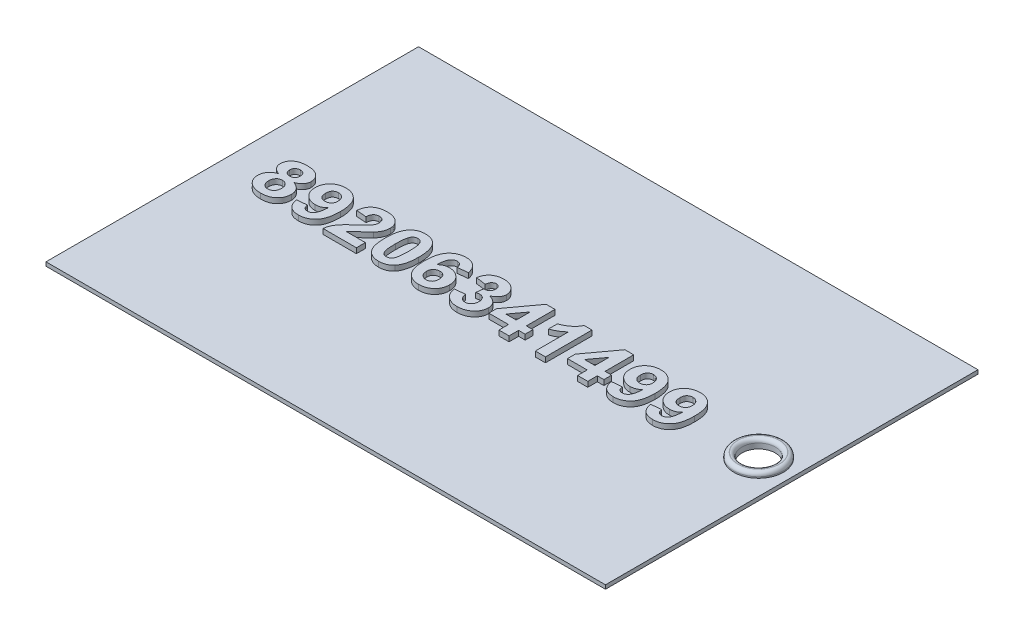
from build123d import *

# Parameters (mm, degrees)
SKETCH_1_W          = 86.5
SKETCH_1_H          = 57.6
EXTRUDE_1_DEPTH     = 0.6
EXTRUDE_2_DEPTH     = 0.8
SKETCH_4_R          = 3.817561334
EXTRUDE_3_DEPTH     = 0.8
SKETCH_6_R          = 2.57898752
CUT_EXTRUDE_1_DEPTH = 1.8
FILLET_1_R          = 0.6


with BuildPart() as part:
    # Эскиз1 → Бобышка-Вытянуть1 (new body)
    with BuildSketch(Plane(origin=(0, 0, 0), x_dir=(1, 0, 0), z_dir=(0, 1, 0))):
        Rectangle(SKETCH_1_W, SKETCH_1_H)
    extrude(amount=EXTRUDE_1_DEPTH)

    # Эскиз2 → Бобышка-Вытянуть2 (add)
    # profile 1 of 11: a face of its own
    with BuildSketch(Plane(origin=(0, 0.6, 0), x_dir=(1, 0, 0), z_dir=(0, 1, 0))):
        with BuildLine():
            add(Edge.make_bspline(
                [(-36.285548398, 0.189662229), (-36.336217326, 0.208249515), (-36.435329018, 0.244607445), (-36.576636112, 0.308436742), (-36.707435743, 0.376604952), (-36.826370801, 0.451592864), (-36.937086754, 0.528059561), (-37.034487713, 0.614103649), (-37.123125063, 0.70282966), (-37.224040922, 0.827712646), (-37.328587221, 0.991967456), (-37.416710796, 1.203180728), (-37.475337374, 1.422983015), (-37.481160232, 1.574149403), (-37.484097118, 1.650393481)],
                knots=[0, 0, 0, 0, 0.958286053, 1.874469368, 2.751924474, 3.575500876, 4.37063306, 5.138446985, 5.88024205, 6.595529584, 7.986847543, 9.320617915, 10.648594961, 12, 12, 12, 12], degree=3))
            add(Edge.make_bspline(
                [(-37.484097118, 1.650393481), (-37.482090341, 1.714839157), (-37.478146025, 1.841506974), (-37.449070542, 2.027277931), (-37.399284622, 2.204302041), (-37.332164765, 2.373660858), (-37.243122203, 2.533595618), (-37.133650181, 2.683858537), (-37.006933234, 2.82689857), (-36.860638307, 2.959716616), (-36.696842178, 3.080367811), (-36.515708278, 3.18664285), (-36.316738031, 3.27331835), (-36.102845759, 3.347967004), (-35.871471108, 3.402834049), (-35.624587499, 3.443454052), (-35.361118613, 3.465853718), (-35.180195806, 3.469425628), (-35.086999679, 3.471265574)],
                knots=[0, 0, 0, 0, 0.914682978, 1.797807145, 2.66113592, 3.520634732, 4.378049579, 5.252103346, 6.155026356, 7.086322986, 8.051602039, 9.038352878, 10.060630283, 11.127721113, 12.250325884, 13.431504408, 14.676928322, 16, 16, 16, 16], degree=3))
            add(Edge.make_bspline(
                [(-35.086999679, 3.471265574), (-34.994763518, 3.469415878), (-34.815279083, 3.46581651), (-34.553732859, 3.443440745), (-34.30825552, 3.402901597), (-34.077973469, 3.347648698), (-33.864746878, 3.27375674), (-33.666356278, 3.185882245), (-33.484369219, 3.080462965), (-33.319151911, 2.959731844), (-33.171535421, 2.826857625), (-33.043111098, 2.684362502), (-32.933970342, 2.533173195), (-32.843322986, 2.373768387), (-32.774425848, 2.204595456), (-32.725021175, 2.027245339), (-32.695829052, 1.841515542), (-32.691900829, 1.714842046), (-32.689902239, 1.650393481)],
                knots=[0, 0, 0, 0, 1.310519152, 2.550168893, 3.725584358, 4.842483071, 5.910449356, 6.927336827, 7.920794406, 8.892366141, 9.829481644, 10.737692221, 11.612463073, 12.473910606, 13.336680849, 14.20071791, 15.084566604, 16, 16, 16, 16], degree=3))
            add(Edge.make_bspline(
                [(-32.689902239, 1.650393481), (-32.690445519, 1.609992), (-32.691523553, 1.529823053), (-32.708926686, 1.411499157), (-32.732438663, 1.296043914), (-32.767703705, 1.184316651), (-32.812001605, 1.076059623), (-32.867783832, 0.972195339), (-32.930986109, 0.870134286), (-33.031693639, 0.740013934), (-33.178902269, 0.587025369), (-33.389707712, 0.430264756), (-33.630252172, 0.292839731), (-33.807196873, 0.224789461), (-33.898534903, 0.189662229)],
                knots=[0, 0, 0, 0, 0.715878892, 1.420523609, 2.117092496, 2.804014019, 3.495199071, 4.188584521, 4.892765842, 5.621847554, 7.103549966, 8.641724018, 10.266473608, 12, 12, 12, 12], degree=3))
            add(Edge.make_bspline(
                [(-33.898534903, 0.189662229), (-33.843051365, 0.169201246), (-33.734127381, 0.129032723), (-33.578444817, 0.058636223), (-33.434041023, -0.02037624), (-33.297532557, -0.102439146), (-33.173959099, -0.196221894), (-33.058428931, -0.293215312), (-32.953224389, -0.397786907), (-32.860789715, -0.510300124), (-32.775896521, -0.626787716), (-32.70504775, -0.749777203), (-32.641139621, -0.875238493), (-32.593480477, -1.006888546), (-32.553893653, -1.141969187), (-32.524608282, -1.281514401), (-32.509222431, -1.426300492), (-32.506757544, -1.524095689), (-32.505510129, -1.57358733)],
                knots=[0, 0, 0, 0, 1.177311303, 2.311270056, 3.397924368, 4.45402987, 5.479033016, 6.482948128, 7.456535392, 8.427348562, 9.379909235, 10.322823475, 11.25073535, 12.179582744, 13.105522015, 14.052499726, 15.014420052, 16, 16, 16, 16], degree=3))
            add(Edge.make_bspline(
                [(-32.505510129, -1.57358733), (-32.507940018, -1.654346328), (-32.51271753, -1.813130167), (-32.543885711, -2.045650498), (-32.599602407, -2.265870339), (-32.674303565, -2.475565792), (-32.772586162, -2.673237646), (-32.893303308, -2.859009058), (-33.035500939, -3.032707319), (-33.197866972, -3.193296371), (-33.377813429, -3.338644341), (-33.572941125, -3.466301155), (-33.783452855, -3.572847711), (-34.007518874, -3.66136674), (-34.246635953, -3.728438447), (-34.499502869, -3.777542272), (-34.767007995, -3.806359166), (-34.950076175, -3.81023757), (-35.043782778, -3.812222799)],
                knots=[0, 0, 0, 0, 1.018464953, 2.00244899, 2.951201689, 3.87829569, 4.804459757, 5.72824528, 6.666426589, 7.629849071, 8.602985074, 9.578811512, 10.56458265, 11.573243485, 12.61213359, 13.691648752, 14.818430642, 16, 16, 16, 16], degree=3))
            add(Edge.make_bspline(
                [(-35.043782778, -3.812222799), (-35.131222507, -3.81036797), (-35.302565562, -3.806733329), (-35.554443769, -3.783941144), (-35.794731837, -3.743844688), (-36.023845072, -3.687191505), (-36.242293185, -3.61610555), (-36.44837178, -3.525069862), (-36.646103988, -3.423478099), (-36.767047724, -3.33963956), (-36.827200224, -3.297941677)],
                knots=[0, 0, 0, 0, 1.112070826, 2.179165159, 3.213263291, 4.207123208, 5.178514106, 6.130358073, 7.070116082, 8, 8, 8, 8], degree=3))
            add(Edge.make_bspline(
                [(-36.827200224, -3.297941677), (-36.894503104, -3.246849777), (-37.026548489, -3.146609646), (-37.195506623, -2.969274872), (-37.344520638, -2.783371637), (-37.462066126, -2.579658255), (-37.556486398, -2.363082996), (-37.61917552, -2.131411253), (-37.662204859, -1.886821), (-37.666359145, -1.718801382), (-37.668489229, -1.632650428)],
                knots=[0, 0, 0, 0, 1.042160326, 2.04467415, 3.016482646, 3.978868424, 4.940760526, 5.926641304, 6.936898956, 8, 8, 8, 8], degree=3))
            add(Edge.make_bspline(
                [(-37.668489229, -1.632650428), (-37.667143745, -1.584602195), (-37.6644739, -1.489260005), (-37.650353513, -1.34754424), (-37.624524559, -1.208678542), (-37.586095233, -1.07341198), (-37.540688476, -0.939913778), (-37.482793766, -0.810509297), (-37.414016998, -0.684435541), (-37.337283421, -0.560527793), (-37.247741226, -0.442278845), (-37.145968536, -0.330481853), (-37.032054799, -0.225638695), (-36.906671624, -0.127308614), (-36.768225101, -0.037766451), (-36.618205594, 0.045161456), (-36.457339475, 0.123990706), (-36.343545893, 0.167491207), (-36.285548398, 0.189662229)],
                knots=[0, 0, 0, 0, 0.941336221, 1.867895066, 2.786591011, 3.703937775, 4.620126515, 5.546494376, 6.476579351, 7.431723818, 8.398651547, 9.377446652, 10.389175869, 11.427786824, 12.494800566, 13.614846226, 14.784351964, 16, 16, 16, 16], degree=3))
        make_face()
        with BuildLine():
            add(Edge.make_bspline(
                [(-35.916764177, 1.542351229), (-35.914096044, 1.48017872), (-35.908982217, 1.361016953), (-35.867601377, 1.192412545), (-35.795134731, 1.045952083), (-35.696662596, 0.92155053), (-35.572061554, 0.82440657), (-35.428406429, 0.7541168), (-35.265424182, 0.713332978), (-35.151100749, 0.708113279), (-35.091321369, 0.705383914)],
                knots=[0, 0, 0, 0, 1.121972408, 2.150407259, 3.108278179, 4.052191964, 4.990713166, 5.936974058, 6.921249925, 8, 8, 8, 8], degree=3))
            add(Edge.make_bspline(
                [(-35.091321369, 0.705383914), (-35.0310374, 0.708013309), (-34.915135388, 0.713068587), (-34.750969824, 0.755407169), (-34.605527694, 0.825975259), (-34.480770781, 0.924452138), (-34.379923784, 1.048903565), (-34.30675944, 1.195690309), (-34.264744147, 1.364798911), (-34.259822528, 1.484005001), (-34.25723518, 1.546672919)],
                knots=[0, 0, 0, 0, 1.079689513, 2.075811998, 3.015368644, 3.959333422, 4.901962196, 5.864590356, 6.8773923, 8, 8, 8, 8], degree=3))
            add(Edge.make_bspline(
                [(-34.25723518, 1.546672919), (-34.259811207, 1.606016294), (-34.2647417, 1.719598992), (-34.307658021, 1.880943237), (-34.378901186, 2.023994422), (-34.479740633, 2.144860471), (-34.601113452, 2.244874184), (-34.744455713, 2.314190068), (-34.904918138, 2.357379702), (-35.018041343, 2.36233431), (-35.076915735, 2.36491291)],
                knots=[0, 0, 0, 0, 1.090784866, 2.087752606, 3.048321147, 4.009174319, 4.964441443, 5.921057094, 6.918024835, 8, 8, 8, 8], degree=3))
            add(Edge.make_bspline(
                [(-35.076915735, 2.36491291), (-35.138153799, 2.362290831), (-35.255471427, 2.357267547), (-35.421822746, 2.315107124), (-35.568419224, 2.243235524), (-35.692245111, 2.142973187), (-35.79371982, 2.021089437), (-35.864806092, 1.877444067), (-35.909559481, 1.715955311), (-35.914300126, 1.601724905), (-35.916764177, 1.542351229)],
                knots=[0, 0, 0, 0, 1.108272365, 2.123187401, 3.084171351, 4.043381648, 4.989083505, 5.934505219, 6.926415291, 8, 8, 8, 8], degree=3))
        make_face(mode=Mode.SUBTRACT)
        with BuildLine():
            add(Edge.make_bspline(
                [(-36.101156288, -1.501559161), (-36.100517912, -1.547700824), (-36.099277669, -1.637345262), (-36.084168562, -1.767818384), (-36.061278165, -1.890614194), (-36.030407288, -2.006341166), (-35.987725597, -2.113487176), (-35.938026463, -2.213746372), (-35.876480996, -2.304830864), (-35.807605681, -2.388443902), (-35.731459074, -2.462890914), (-35.650539894, -2.528248671), (-35.565076196, -2.583331306), (-35.474905227, -2.628644822), (-35.379989905, -2.662925868), (-35.280482825, -2.687258039), (-35.176897373, -2.704260864), (-35.105797549, -2.705328359), (-35.069712918, -2.705870134)],
                knots=[0, 0, 0, 0, 1.241599918, 2.412191547, 3.530285543, 4.60283893, 5.630272913, 6.630426839, 7.609216693, 8.582442034, 9.542267977, 10.470946533, 11.378143532, 12.27422023, 13.18206171, 14.088152821, 15.029698039, 16, 16, 16, 16], degree=3))
            add(Edge.make_bspline(
                [(-35.069712918, -2.705870134), (-35.034619537, -2.70512215), (-34.965086426, -2.703640115), (-34.863504305, -2.689463199), (-34.766932059, -2.663837129), (-34.674476469, -2.631834949), (-34.58757203, -2.586932485), (-34.503549459, -2.536525731), (-34.426682367, -2.472380546), (-34.353395957, -2.401466425), (-34.287009193, -2.320434415), (-34.228730427, -2.230909259), (-34.181879195, -2.131479838), (-34.140837484, -2.02543272), (-34.111374564, -1.909680537), (-34.087870701, -1.786648546), (-34.075255514, -1.654520587), (-34.073662996, -1.564007197), (-34.07284307, -1.517405358)],
                knots=[0, 0, 0, 0, 0.962437785, 1.906949137, 2.804742188, 3.700600337, 4.584269373, 5.483510867, 6.38255937, 7.32338912, 8.278042554, 9.249989229, 10.245659391, 11.287906134, 12.364710024, 13.517024084, 14.721611888, 16, 16, 16, 16], degree=3))
            add(Edge.make_bspline(
                [(-34.07284307, -1.517405358), (-34.073672867, -1.47656049), (-34.075297783, -1.396577707), (-34.088033768, -1.279316984), (-34.111413714, -1.168090889), (-34.142744795, -1.062827415), (-34.183121935, -0.964271625), (-34.232955509, -0.872131552), (-34.291528168, -0.785888924), (-34.359763761, -0.707319797), (-34.432380741, -0.634626253), (-34.512498014, -0.573034785), (-34.596184757, -0.518679526), (-34.685867139, -0.475579924), (-34.780264437, -0.442621268), (-34.878959903, -0.417623083), (-34.982841531, -0.403085524), (-35.053821713, -0.401681843), (-35.089880805, -0.40096875)],
                knots=[0, 0, 0, 0, 1.155918347, 2.263529552, 3.33235739, 4.368544216, 5.367983109, 6.340920378, 7.328554279, 8.31178347, 9.282439969, 10.231253058, 11.166241316, 12.10231545, 13.039375653, 13.991977209, 14.979891594, 16, 16, 16, 16], degree=3))
            add(Edge.make_bspline(
                [(-35.089880805, -0.40096875), (-35.13122014, -0.402151266), (-35.21133457, -0.404442948), (-35.3274248, -0.419910674), (-35.434903894, -0.44789001), (-35.535105565, -0.484654002), (-35.626990849, -0.53449694), (-35.710640932, -0.595147345), (-35.786333712, -0.666224068), (-35.873481092, -0.774264079), (-35.963363966, -0.920609431), (-36.042284, -1.107598405), (-36.092131308, -1.302105399), (-36.098144813, -1.435005011), (-36.101156288, -1.501559161)],
                knots=[0, 0, 0, 0, 0.887516411, 1.719981036, 2.507577094, 3.267707935, 4.005706678, 4.743921389, 5.480478727, 6.227565498, 7.718071651, 9.150217807, 10.572871435, 12, 12, 12, 12], degree=3))
        make_face(mode=Mode.SUBTRACT)
    # profile 2 of 11: a face of its own
    with BuildSketch(Plane(origin=(0, 0.6, 0), x_dir=(1, 0, 0), z_dir=(0, 1, 0))):
        with BuildLine():
            Line((-31.399157464, -1.936609298), (-29.831824523, -1.783909581))
            add(Edge.make_bspline(
                [(-29.831824523, -1.783909581), (-29.821564595, -1.850054803), (-29.802171542, -1.975080793), (-29.747698967, -2.148352361), (-29.671713147, -2.294389344), (-29.574494704, -2.413789744), (-29.456788435, -2.50458782), (-29.321630608, -2.56856708), (-29.16978879, -2.606748116), (-29.063272585, -2.61130293), (-29.007822279, -2.613674079)],
                knots=[0, 0, 0, 0, 1.231193047, 2.327169275, 3.327745251, 4.244636558, 5.139439171, 6.041029258, 6.980197158, 8, 8, 8, 8], degree=3))
            add(Edge.make_bspline(
                [(-29.007822279, -2.613674079), (-28.971688482, -2.612884933), (-28.900266715, -2.611325113), (-28.79564049, -2.589175552), (-28.694479303, -2.558652712), (-28.598074653, -2.512544224), (-28.506186222, -2.455148506), (-28.41812306, -2.384623392), (-28.335624906, -2.300681812), (-28.253771166, -2.204366103), (-28.178856038, -2.086346885), (-28.114206466, -1.94217148), (-28.053891721, -1.773158707), (-28.000745932, -1.577687302), (-27.957651174, -1.355452715), (-27.91914837, -1.107470043), (-27.885202643, -0.83326315), (-27.871289173, -0.641145747), (-27.864014967, -0.540703397)],
                knots=[0, 0, 0, 0, 0.661879668, 1.308265946, 1.954892471, 2.597483001, 3.26258152, 3.939714808, 4.662557812, 5.419667133, 6.255744316, 7.217765111, 8.313252526, 9.546818957, 10.931172992, 12.46549124, 14.152096776, 16, 16, 16, 16], degree=3))
            add(Edge.make_bspline(
                [(-27.864014967, -0.540703397), (-27.912077522, -0.588293592), (-28.007337318, -0.682617174), (-28.164780232, -0.804931633), (-28.3315346, -0.908082145), (-28.507182071, -0.991583243), (-28.69053792, -1.059146252), (-28.884169137, -1.104047751), (-29.086077258, -1.134613171), (-29.224268784, -1.137215004), (-29.294494388, -1.138537193)],
                knots=[0, 0, 0, 0, 1.016554157, 2.014806384, 2.99086776, 3.959930652, 4.935430789, 5.923362918, 6.944703054, 8, 8, 8, 8], degree=3))
            add(Edge.make_bspline(
                [(-29.294494388, -1.138537193), (-29.370929704, -1.136511256), (-29.521946174, -1.132508526), (-29.744408577, -1.103382513), (-29.959066352, -1.054209545), (-30.165783838, -0.98511896), (-30.363700596, -0.895021852), (-30.554024203, -0.786422476), (-30.735380113, -0.656988684), (-30.909509506, -0.512138885), (-31.066047116, -0.348301262), (-31.206697516, -0.174011022), (-31.322211711, 0.015509487), (-31.417109257, 0.216118813), (-31.49296507, 0.427736667), (-31.545974891, 0.651374994), (-31.578362039, 0.88689803), (-31.581797653, 1.048132074), (-31.583549575, 1.130350106)],
                knots=[0, 0, 0, 0, 1.01884352, 2.012972034, 2.985091286, 3.950717898, 4.91336916, 5.87969577, 6.867227362, 7.88032292, 8.894449453, 9.883225206, 10.860390094, 11.84542865, 12.837576497, 13.851480752, 14.904406168, 16, 16, 16, 16], degree=3))
            add(Edge.make_bspline(
                [(-31.583549575, 1.130350106), (-31.581135419, 1.215909094), (-31.576398726, 1.383780036), (-31.545195387, 1.629164517), (-31.489822398, 1.861656075), (-31.413530503, 2.081475065), (-31.315436792, 2.289321284), (-31.193097387, 2.482540039), (-31.051429964, 2.664717155), (-30.886929142, 2.830030093), (-30.707784297, 2.981453567), (-30.514312487, 3.113070619), (-30.307654842, 3.22300507), (-30.090148815, 3.313716529), (-29.860620869, 3.384953228), (-29.619402367, 3.434706942), (-29.365896907, 3.465837738), (-29.192786968, 3.469430121), (-29.104340024, 3.471265574)],
                knots=[0, 0, 0, 0, 1.072024232, 2.103364261, 3.092786983, 4.061299559, 5.013985084, 5.965511011, 6.921155665, 7.899689109, 8.881878012, 9.856426617, 10.825443631, 11.809841357, 12.805118757, 13.831709527, 14.892156814, 16, 16, 16, 16], degree=3))
            add(Edge.make_bspline(
                [(-29.104340024, 3.471265574), (-29.008661189, 3.468802344), (-28.820331603, 3.463953839), (-28.544387055, 3.424906316), (-28.28218581, 3.357730728), (-28.032227736, 3.267402563), (-27.796590471, 3.148425708), (-27.573996486, 3.002797135), (-27.365499566, 2.83070865), (-27.168908229, 2.633724759), (-26.989492819, 2.406616685), (-26.837556478, 2.142788317), (-26.707713453, 1.846570165), (-26.601780783, 1.516830249), (-26.520619839, 1.153130398), (-26.462854899, 0.756351924), (-26.426117607, 0.325765591), (-26.422464709, 0.027437992), (-26.420570475, -0.127261711)],
                knots=[0, 0, 0, 0, 0.901643998, 1.774752374, 2.620046557, 3.449140987, 4.275016872, 5.10233027, 5.951360725, 6.818713095, 7.721447077, 8.670848442, 9.680069745, 10.76504824, 11.930062553, 13.188538504, 14.542098488, 16, 16, 16, 16], degree=3))
            add(Edge.make_bspline(
                [(-26.420570475, -0.127261711), (-26.422338153, -0.284370687), (-26.425754683, -0.588027529), (-26.464350915, -1.026255369), (-26.523203352, -1.430861038), (-26.607221207, -1.801922474), (-26.717940615, -2.138562924), (-26.85170813, -2.442422623), (-27.009782163, -2.71299869), (-27.194948703, -2.94759973), (-27.397992016, -3.151847925), (-27.616332696, -3.328739656), (-27.850077273, -3.477748935), (-28.097178436, -3.601646353), (-28.360281503, -3.694952557), (-28.637281481, -3.762465605), (-28.929141777, -3.80592374), (-29.12915314, -3.810095984), (-29.2311096, -3.812222799)],
                knots=[0, 0, 0, 0, 1.432153676, 2.768035743, 4.007693005, 5.15793701, 6.232359531, 7.233943367, 8.180075472, 9.081348856, 9.951322331, 10.801277852, 11.638106955, 12.474202681, 13.316238609, 14.177453051, 15.070950615, 16, 16, 16, 16], degree=3))
            add(Edge.make_bspline(
                [(-29.2311096, -3.812222799), (-29.304629942, -3.810884117), (-29.448160878, -3.80827066), (-29.658267565, -3.786576206), (-29.857252883, -3.749329132), (-30.044989984, -3.697160412), (-30.222517281, -3.632654987), (-30.389118684, -3.551603949), (-30.544372392, -3.454682661), (-30.690091794, -3.344911249), (-30.822782176, -3.219141434), (-30.942789149, -3.078163215), (-31.051289649, -2.923607542), (-31.146560439, -2.754129066), (-31.228337761, -2.570027786), (-31.29911797, -2.37226295), (-31.356724691, -2.159699585), (-31.384777381, -2.01221258), (-31.399157464, -1.936609298)],
                knots=[0, 0, 0, 0, 1.112623894, 2.17213286, 3.192787055, 4.173209248, 5.118323106, 6.047995836, 6.971740124, 7.884640988, 8.804947649, 9.732828744, 10.682542674, 11.658888362, 12.670653346, 13.728166063, 14.835435681, 16, 16, 16, 16], degree=3))
        make_face()
        with BuildLine():
            add(Edge.make_bspline(
                [(-27.987903416, 1.095776586), (-27.989225744, 1.141422065), (-27.991793575, 1.230061143), (-28.005426373, 1.359014349), (-28.031839292, 1.479493862), (-28.067792296, 1.592455358), (-28.113622187, 1.698027886), (-28.170578959, 1.795378626), (-28.236680076, 1.885304524), (-28.338337929, 1.991215341), (-28.47808328, 2.10308682), (-28.663198349, 2.202467214), (-28.862474222, 2.262560892), (-29.000216063, 2.269309339), (-29.069766503, 2.272716855)],
                knots=[0, 0, 0, 0, 0.91799807, 1.782662894, 2.60262069, 3.393412986, 4.162938389, 4.911402136, 5.65674597, 6.401151281, 7.857682046, 9.235448926, 10.60408614, 12, 12, 12, 12], degree=3))
            add(Edge.make_bspline(
                [(-29.069766503, 2.272716855), (-29.134890107, 2.269845668), (-29.261708514, 2.264254465), (-29.443101733, 2.215728382), (-29.606809189, 2.134504672), (-29.727350751, 2.041872269), (-29.813035699, 1.952232492), (-29.866982503, 1.87228354), (-29.913844889, 1.783551382), (-29.950831645, 1.684102156), (-29.981432683, 1.575371542), (-30.000479151, 1.455471874), (-30.014046542, 1.32657872), (-30.015478938, 1.236991786), (-30.016216634, 1.190853768)],
                knots=[0, 0, 0, 0, 1.431664542, 2.787951052, 4.097338494, 5.431366142, 6.111873526, 6.818476973, 7.546573036, 8.316072833, 9.149487248, 10.028760014, 10.984794968, 12, 12, 12, 12], degree=3))
            add(Edge.make_bspline(
                [(-30.016216634, 1.190853768), (-30.015599855, 1.143748654), (-30.014407174, 1.052660372), (-29.9992135, 0.920780596), (-29.977079507, 0.798695912), (-29.944950789, 0.686387119), (-29.904921073, 0.583120832), (-29.854822709, 0.48959384), (-29.794783982, 0.405738101), (-29.703055437, 0.309391902), (-29.572336421, 0.208732719), (-29.394611679, 0.123192974), (-29.199214208, 0.068888171), (-29.062451612, 0.063030209), (-28.991976082, 0.060011526)],
                knots=[0, 0, 0, 0, 0.979097379, 1.893303947, 2.757030447, 3.556730337, 4.31888723, 5.056103087, 5.757267517, 6.456651888, 7.816854138, 9.161164295, 10.537111332, 12, 12, 12, 12], degree=3))
            add(Edge.make_bspline(
                [(-28.991976082, 0.060011526), (-28.92389319, 0.062560024), (-28.791000558, 0.067534498), (-28.601569127, 0.120890486), (-28.427134399, 0.201424951), (-28.300146021, 0.298768398), (-28.209303611, 0.390075996), (-28.150445732, 0.468487791), (-28.099368497, 0.55429968), (-28.057718151, 0.648049407), (-28.025776004, 0.749553071), (-28.005388193, 0.858446618), (-27.989603383, 0.974316268), (-27.988482246, 1.054419973), (-27.987903416, 1.095776586)],
                knots=[0, 0, 0, 0, 1.500879801, 2.929603369, 4.315716618, 5.725035421, 6.437957177, 7.157483113, 7.885489455, 8.640828255, 9.419513109, 10.231197387, 11.086787741, 12, 12, 12, 12], degree=3))
        make_face(mode=Mode.SUBTRACT)
    # profile 3 of 11: a face of its own
    with BuildSketch(Plane(origin=(0, 0.6, 0), x_dir=(1, 0, 0), z_dir=(0, 1, 0))):
        with BuildLine():
            Line((-20.335630822, -2.337085913), (-20.335630822, -3.720026743))
            Line((-20.335630822, -3.720026743), (-25.498609922, -3.720026743))
            add(Edge.make_bspline(
                [(-25.498609922, -3.720026743), (-25.480799957, -3.601786717), (-25.445138625, -3.365031804), (-25.339992547, -3.019138653), (-25.196355403, -2.682374976), (-25.041658042, -2.408776215), (-24.888903576, -2.187961761), (-24.748302836, -2.008197999), (-24.583718602, -1.814753993), (-24.392871548, -1.610073674), (-24.179573887, -1.389612341), (-23.938431186, -1.159597123), (-23.674940433, -0.913428403), (-23.4880167, -0.748627766), (-23.391065719, -0.663151283)],
                knots=[0, 0, 0, 0, 1.129476727, 2.261579045, 3.406926059, 4.586285963, 5.226122553, 5.94455893, 6.743413178, 7.627078971, 8.590393361, 9.643699672, 10.777867183, 12, 12, 12, 12], degree=3))
            add(Edge.make_bspline(
                [(-23.391065719, -0.663151283), (-23.31420272, -0.594521951), (-23.167851859, -0.463848388), (-22.959412275, -0.276697591), (-22.775343121, -0.105355697), (-22.61441449, 0.048250464), (-22.476166992, 0.183811233), (-22.362849779, 0.303413051), (-22.270708611, 0.404335341), (-22.221437061, 0.469305934), (-22.199719816, 0.497942789)],
                knots=[0, 0, 0, 0, 1.484766696, 2.827067485, 4.036323289, 5.10806564, 6.032765945, 6.825596682, 7.482362455, 8, 8, 8, 8], degree=3))
            add(Edge.make_bspline(
                [(-22.199719816, 0.497942789), (-22.154622499, 0.566971834), (-22.067982945, 0.699588276), (-21.97241575, 0.90948264), (-21.914702569, 1.119582156), (-21.906828787, 1.260147943), (-21.902963763, 1.329147851)],
                knots=[0, 0, 0, 0, 1.102927588, 2.118909982, 3.076624261, 4, 4, 4, 4], degree=3))
            add(Edge.make_bspline(
                [(-21.902963763, 1.329147851), (-21.905249173, 1.400963923), (-21.909579873, 1.537050598), (-21.954737607, 1.728372605), (-22.029884643, 1.894101283), (-22.136777163, 2.031380628), (-22.269627675, 2.140587425), (-22.42628546, 2.219490851), (-22.607398897, 2.264079369), (-22.734878396, 2.269741251), (-22.801875303, 2.272716855)],
                knots=[0, 0, 0, 0, 1.163090258, 2.203978577, 3.165718603, 4.092675497, 5.000155709, 5.933633661, 6.914020271, 8, 8, 8, 8], degree=3))
            add(Edge.make_bspline(
                [(-22.801875303, 2.272716855), (-22.867954496, 2.26993862), (-22.994797081, 2.264605647), (-23.17497403, 2.216484331), (-23.332664512, 2.133594834), (-23.446415382, 2.03942691), (-23.523063087, 1.946934412), (-23.575331749, 1.86676975), (-23.62115259, 1.775961679), (-23.659992329, 1.674553738), (-23.691268548, 1.562521518), (-23.717232096, 1.440373777), (-23.735633889, 1.306971276), (-23.743038905, 1.214428431), (-23.74688487, 1.166364191)],
                knots=[0, 0, 0, 0, 1.446541196, 2.776714027, 4.047779858, 5.325278425, 5.982890428, 6.674732488, 7.41842877, 8.208071155, 9.050911754, 9.965360861, 10.943263679, 12, 12, 12, 12], degree=3))
            Line((-23.74688487, 1.166364191), (-25.314217811, 1.301777147))
            add(Edge.make_bspline(
                [(-25.314217811, 1.301777147), (-25.301777475, 1.395186991), (-25.277629006, 1.576508844), (-25.217958402, 1.836636123), (-25.142600931, 2.076691424), (-25.048069797, 2.296058025), (-24.938061831, 2.496350994), (-24.807431695, 2.674195753), (-24.660296472, 2.832265498), (-24.495411688, 2.969085675), (-24.315390319, 3.086066098), (-24.126934456, 3.190902387), (-23.926482871, 3.277517442), (-23.715138434, 3.34762546), (-23.49343868, 3.404627361), (-23.26046647, 3.441950251), (-23.017600762, 3.468228456), (-22.851889879, 3.470239186), (-22.767301782, 3.471265574)],
                knots=[0, 0, 0, 0, 1.209071725, 2.346980976, 3.421064628, 4.434374677, 5.408437173, 6.347872138, 7.259308193, 8.173989875, 9.090310792, 10.011696864, 10.939227016, 11.888478621, 12.867676192, 13.8739127, 14.914726209, 16, 16, 16, 16], degree=3))
            add(Edge.make_bspline(
                [(-22.767301782, 3.471265574), (-22.675053325, 3.469642298), (-22.495455152, 3.466481946), (-22.233743461, 3.440949106), (-21.98756822, 3.395206046), (-21.755335727, 3.336732679), (-21.539250987, 3.256130993), (-21.337545601, 3.160434853), (-21.152790964, 3.043703023), (-20.982745402, 2.91372224), (-20.832117712, 2.768981803), (-20.698139924, 2.616913143), (-20.586962013, 2.453644934), (-20.493395121, 2.283545361), (-20.42275689, 2.103224934), (-20.372319699, 1.914809268), (-20.341174409, 1.717693556), (-20.337498657, 1.583281867), (-20.335630822, 1.514980525)],
                knots=[0, 0, 0, 0, 1.265063819, 2.462947978, 3.60097199, 4.696747314, 5.742727476, 6.758926912, 7.752990665, 8.734342278, 9.689262861, 10.613604176, 11.508696777, 12.392746404, 13.270815088, 14.157436591, 15.063700826, 16, 16, 16, 16], degree=3))
            add(Edge.make_bspline(
                [(-20.335630822, 1.514980525), (-20.337762546, 1.436569408), (-20.341994709, 1.280897943), (-20.378505383, 1.0509132), (-20.433670516, 0.825932665), (-20.516508398, 0.605883054), (-20.623197932, 0.386390523), (-20.755701115, 0.163700918), (-20.914191908, -0.06396187), (-21.03519009, -0.212091795), (-21.097688842, -0.288604808)],
                knots=[0, 0, 0, 0, 0.939476924, 1.865166004, 2.785271292, 3.712391279, 4.677910533, 5.707657932, 6.815944874, 8, 8, 8, 8], degree=3))
            add(Edge.make_bspline(
                [(-21.097688842, -0.288604808), (-21.122014264, -0.316124507), (-21.174009212, -0.374947138), (-21.260867179, -0.465865035), (-21.36187875, -0.564656958), (-21.475778925, -0.67314902), (-21.60428664, -0.789554366), (-21.746408521, -0.915021782), (-21.904418305, -1.046808029), (-22.068995478, -1.185825627), (-22.23386787, -1.32132805), (-22.385893484, -1.449294231), (-22.522045584, -1.564727412), (-22.641115866, -1.668542728), (-22.744907299, -1.758687455), (-22.831761747, -1.83702379), (-22.902818132, -1.902393161), (-23.000755223, -2.004443725), (-23.125877758, -2.141399176), (-23.214822909, -2.274046442), (-23.257093326, -2.337085913)],
                knots=[0, 0, 0, 0, 0.664437529, 1.420217667, 2.274078834, 3.220377861, 4.265797111, 5.410719718, 6.649816042, 7.987887578, 9.308159569, 10.510534661, 11.582823297, 12.537340636, 13.368449574, 14.0696897, 14.653539676, 15.114285161, 16.628588878, 18, 18, 18, 18], degree=3))
            Line((-23.257093326, -2.337085913), (-20.335630822, -2.337085913))
        make_face()
    # profile 4 of 11: a face of its own
    with BuildSketch(Plane(origin=(0, 0.6, 0), x_dir=(1, 0, 0), z_dir=(0, 1, 0))):
        with BuildLine():
            add(Edge.make_bspline(
                [(-16.832180718, 3.471265574), (-16.738432579, 3.469170439), (-16.555550316, 3.465083285), (-16.28924115, 3.429853583), (-16.038216072, 3.372449554), (-15.802743952, 3.292059674), (-15.5826398, 3.188056449), (-15.380673774, 3.057794802), (-15.190774155, 2.909099497), (-15.080932849, 2.791417015), (-15.025714259, 2.732256568)],
                knots=[0, 0, 0, 0, 1.116340652, 2.177738199, 3.193406861, 4.179258887, 5.136143586, 6.085062405, 7.037337072, 8, 8, 8, 8], degree=3))
            add(Edge.make_bspline(
                [(-15.025714259, 2.732256568), (-14.993880044, 2.694804407), (-14.929236482, 2.618752868), (-14.842851348, 2.494334374), (-14.759179927, 2.363177222), (-14.685606058, 2.220912179), (-14.613735281, 2.071406067), (-14.551670837, 1.911433474), (-14.493380593, 1.743436744), (-14.441610767, 1.566593986), (-14.397246842, 1.379901508), (-14.358551823, 1.184287588), (-14.325533571, 0.979586721), (-14.298244337, 0.766262099), (-14.276856556, 0.544301627), (-14.26064303, 0.313279709), (-14.252394373, 0.073038794), (-14.251265435, -0.090281918), (-14.250691168, -0.173359739)],
                knots=[0, 0, 0, 0, 0.768149118, 1.559827843, 2.366078024, 3.19908553, 4.062305773, 4.958844896, 5.880163783, 6.842457966, 7.838634207, 8.879724376, 9.959831673, 11.0802147, 12.24200117, 13.446202482, 14.700936759, 16, 16, 16, 16], degree=3))
            add(Edge.make_bspline(
                [(-14.250691168, -0.173359739), (-14.251258129, -0.256437746), (-14.252369429, -0.419278948), (-14.260685241, -0.659037813), (-14.276867776, -0.889577733), (-14.298194077, -1.111551281), (-14.325713897, -1.324829257), (-14.357855789, -1.529324382), (-14.399327309, -1.723995585), (-14.442985077, -1.910435398), (-14.494746666, -2.087948829), (-14.554521736, -2.25608976), (-14.617058873, -2.416937384), (-14.687716785, -2.567804773), (-14.764263479, -2.709675561), (-14.846610655, -2.842352485), (-14.933998579, -2.967443446), (-14.99916313, -3.043929671), (-15.031476512, -3.081857173)],
                knots=[0, 0, 0, 0, 1.297160023, 2.542563356, 3.745000429, 4.905084801, 6.023826389, 7.102351253, 8.136059708, 9.130776481, 10.091660836, 11.021173619, 11.91639925, 12.785143122, 13.620470683, 14.431903381, 15.222422241, 16, 16, 16, 16], degree=3))
            add(Edge.make_bspline(
                [(-15.031476512, -3.081857173), (-15.086845884, -3.140355718), (-15.196497521, -3.256204264), (-15.38337274, -3.405708228), (-15.585833616, -3.531269205), (-15.804410561, -3.634221061), (-16.038397744, -3.71557595), (-16.28948065, -3.770252385), (-16.555514305, -3.806195139), (-16.738420375, -3.810180066), (-16.832180718, -3.812222799)],
                knots=[0, 0, 0, 0, 0.963042427, 1.907176745, 2.854384039, 3.808053903, 4.793049076, 5.812153135, 6.878477497, 8, 8, 8, 8], degree=3))
            add(Edge.make_bspline(
                [(-16.832180718, -3.812222799), (-16.926912418, -3.809779803), (-17.111861744, -3.805010222), (-17.382040657, -3.766337867), (-17.638697313, -3.705048483), (-17.881345942, -3.617114441), (-18.109498229, -3.503380364), (-18.324308859, -3.366250818), (-18.523487777, -3.201889673), (-18.677521266, -3.046159041), (-18.792399341, -2.907538821), (-18.872549313, -2.791943733), (-18.94798333, -2.667526386), (-19.016980458, -2.533110914), (-19.080418332, -2.388771032), (-19.137559542, -2.234050245), (-19.190912469, -2.070309799), (-19.238462619, -1.896769816), (-19.280104849, -1.713618896), (-19.315936492, -1.520407441), (-19.346225283, -1.31715533), (-19.36982541, -1.104199712), (-19.391151348, -0.881955579), (-19.402695912, -0.649791878), (-19.412256501, -0.407770086), (-19.413192733, -0.242997961), (-19.413670268, -0.158954105)],
                knots=[0, 0, 0, 0, 1.336956711, 2.610205926, 3.845082282, 5.05679543, 6.245299989, 7.437588374, 8.64679547, 9.883642899, 10.524261855, 11.186297686, 11.867630116, 12.577150567, 13.317825726, 14.092264323, 14.904816371, 15.74855914, 16.631718945, 17.555848619, 18.522303531, 19.532268663, 20.580618725, 21.673824082, 22.813508086, 24, 24, 24, 24], degree=3))
            add(Edge.make_bspline(
                [(-19.413670268, -0.158954105), (-19.413107941, -0.076355891), (-19.41200585, 0.085525993), (-19.403610568, 0.324319008), (-19.387599347, 0.553913868), (-19.36602074, 0.775377676), (-19.33886229, 0.987752317), (-19.306155704, 1.191655737), (-19.26565071, 1.386190567), (-19.219268248, 1.571449719), (-19.169898933, 1.749130558), (-19.109658762, 1.916510984), (-19.047709528, 2.077126274), (-18.976243246, 2.227140619), (-18.900147859, 2.368741331), (-18.817738009, 2.501389375), (-18.730365955, 2.626487649), (-18.665199334, 2.70297292), (-18.632884925, 2.740899948)],
                knots=[0, 0, 0, 0, 1.293231498, 2.534567525, 3.740331748, 4.896143442, 6.017980594, 7.092068857, 8.128637588, 9.127890194, 10.08211952, 11.01420427, 11.911906995, 12.776247596, 13.613886512, 14.427564449, 15.22027068, 16, 16, 16, 16], degree=3))
            add(Edge.make_bspline(
                [(-18.632884925, 2.740899948), (-18.577517828, 2.799403578), (-18.467870698, 2.915262193), (-18.280962151, 3.064691697), (-18.078258463, 3.19076587), (-17.859178713, 3.29256079), (-17.625613087, 3.374964635), (-17.374854202, 3.42922421), (-17.108854313, 3.46525708), (-16.925943495, 3.469229337), (-16.832180718, 3.471265574)],
                knots=[0, 0, 0, 0, 0.963070378, 1.907232097, 2.854466881, 3.813361818, 4.792956001, 5.812089638, 6.878444947, 8, 8, 8, 8], degree=3))
        make_face()
        with BuildLine():
            add(Edge.make_bspline(
                [(-16.832180718, 2.272716855), (-16.878447863, 2.270803887), (-16.969030893, 2.267058629), (-17.100995408, 2.236686916), (-17.225871017, 2.189528194), (-17.343394987, 2.120895928), (-17.451552441, 2.026796946), (-17.54380923, 1.900177143), (-17.624382623, 1.745088937), (-17.664034556, 1.628479541), (-17.68499423, 1.566840806)],
                knots=[0, 0, 0, 0, 0.924396606, 1.809807974, 2.694437751, 3.585508084, 4.517852362, 5.539680896, 6.699496232, 8, 8, 8, 8], degree=3))
            add(Edge.make_bspline(
                [(-17.68499423, 1.566840806), (-17.698056056, 1.520405994), (-17.726116771, 1.420650107), (-17.758229017, 1.257883757), (-17.784826403, 1.073160365), (-17.808214008, 0.866627017), (-17.824428012, 0.637835199), (-17.837799266, 0.387156672), (-17.844402419, 0.114307367), (-17.845675193, -0.074918782), (-17.846337327, -0.173359739)],
                knots=[0, 0, 0, 0, 0.660252385, 1.418419934, 2.269194707, 3.215235024, 4.263575872, 5.409092646, 6.652134504, 8, 8, 8, 8], degree=3))
            add(Edge.make_bspline(
                [(-17.846337327, -0.173359739), (-17.845535808, -0.271318212), (-17.84399943, -0.459088177), (-17.839281322, -0.728574012), (-17.827427817, -0.973990277), (-17.812060935, -1.195954372), (-17.792069278, -1.3943796), (-17.768835374, -1.569170167), (-17.738124691, -1.719437499), (-17.696561438, -1.883308229), (-17.631359827, -2.053708688), (-17.546698205, -2.227876072), (-17.451065351, -2.365220803), (-17.34205911, -2.464681939), (-17.223949984, -2.531410962), (-17.100877772, -2.579898515), (-16.968791731, -2.607464913), (-16.878401382, -2.611573284), (-16.832180718, -2.613674079)],
                knots=[0, 0, 0, 0, 1.595810556, 3.058901205, 4.390151034, 5.597842767, 6.68285049, 7.638635466, 8.468565781, 9.180044325, 10.39036775, 11.432838799, 12.329430933, 13.099234835, 13.814316259, 14.527555626, 15.247072764, 16, 16, 16, 16], degree=3))
            add(Edge.make_bspline(
                [(-16.832180718, -2.613674079), (-16.785930111, -2.611698651), (-16.694910274, -2.607811067), (-16.562703889, -2.578199088), (-16.438190918, -2.530060341), (-16.320851948, -2.461972683), (-16.212987792, -2.367266309), (-16.118643868, -2.242046872), (-16.040456231, -2.085523155), (-16.00051684, -1.969328254), (-15.979367206, -1.90779803)],
                knots=[0, 0, 0, 0, 0.92418851, 1.818775815, 2.694249029, 3.585118767, 4.51725316, 5.544655608, 6.699788997, 8, 8, 8, 8], degree=3))
            add(Edge.make_bspline(
                [(-15.979367206, -1.90779803), (-15.966324377, -1.861359193), (-15.938431717, -1.762047713), (-15.906093391, -1.600298681), (-15.879421442, -1.41653292), (-15.856247975, -1.210937259), (-15.839854931, -0.982640103), (-15.826577929, -0.73243433), (-15.819967423, -0.460066706), (-15.818688093, -0.271320599), (-15.818024109, -0.173359739)],
                knots=[0, 0, 0, 0, 0.662411386, 1.416595652, 2.263628329, 3.212762163, 4.257953731, 5.407216301, 6.654322858, 8, 8, 8, 8], degree=3))
            add(Edge.make_bspline(
                [(-15.818024109, -0.173359739), (-15.818820538, -0.075400756), (-15.820347157, 0.112370185), (-15.825140315, 0.382328985), (-15.836817111, 0.628245827), (-15.852477959, 0.850159805), (-15.87154785, 1.048340999), (-15.898173735, 1.222052911), (-15.925155086, 1.373199642), (-15.970727351, 1.536342599), (-16.032027894, 1.708436355), (-16.117768906, 1.882604224), (-16.213683613, 2.020018714), (-16.322252769, 2.120613992), (-16.43999011, 2.189367187), (-16.563729614, 2.236963508), (-16.695350407, 2.267012255), (-16.78592029, 2.270788209), (-16.832180718, 2.272716855)],
                knots=[0, 0, 0, 0, 1.594097831, 3.055618199, 4.393244489, 5.599640052, 6.675709638, 7.631587258, 8.459115708, 9.171846621, 10.385508173, 11.426860377, 12.322490231, 13.09672995, 13.815007491, 14.527481364, 15.247880853, 16, 16, 16, 16], degree=3))
        make_face(mode=Mode.SUBTRACT)
    # profile 5 of 11: a face of its own
    with BuildSketch(Plane(origin=(0, 0.6, 0), x_dir=(1, 0, 0), z_dir=(0, 1, 0))):
        with BuildLine():
            Line((-8.350143626, 1.59421151), (-9.917476567, 1.442952357))
            add(Edge.make_bspline(
                [(-9.917476567, 1.442952357), (-9.926879762, 1.509686236), (-9.944625912, 1.635629538), (-10.002133932, 1.807734246), (-10.076011037, 1.954676283), (-10.174858965, 2.071891341), (-10.290568862, 2.163303085), (-10.423250877, 2.2276246), (-10.57179974, 2.265675857), (-10.675943351, 2.270312302), (-10.729954305, 2.272716855)],
                knots=[0, 0, 0, 0, 1.24815344, 2.35557362, 3.352034663, 4.281883764, 5.176746509, 6.069432672, 6.998769271, 8, 8, 8, 8], degree=3))
            add(Edge.make_bspline(
                [(-10.729954305, 2.272716855), (-10.766552279, 2.271868371), (-10.839367121, 2.270180238), (-10.945639101, 2.248769918), (-11.048240249, 2.21695543), (-11.146370633, 2.172482988), (-11.239522653, 2.113366214), (-11.328660969, 2.043158901), (-11.41308368, 1.959150984), (-11.495261683, 1.862564396), (-11.569747021, 1.743882844), (-11.637550169, 1.601599792), (-11.695435558, 1.431589413), (-11.746070997, 1.23532666), (-11.792700689, 1.013427371), (-11.82840542, 0.764502449), (-11.861228731, 0.489402041), (-11.874189137, 0.296347417), (-11.880964433, 0.195424483)],
                knots=[0, 0, 0, 0, 0.667223093, 1.327498168, 1.970791897, 2.625983588, 3.287654104, 3.980478248, 4.69342329, 5.458978853, 6.290746786, 7.243623896, 8.33053425, 9.563927688, 10.942903473, 12.467978657, 14.153569439, 16, 16, 16, 16], degree=3))
            add(Edge.make_bspline(
                [(-11.880964433, 0.195424483), (-11.833486553, 0.243605565), (-11.73964174, 0.338840328), (-11.582860588, 0.460451035), (-11.419069602, 0.565899043), (-11.246034842, 0.651034874), (-11.063989741, 0.715700392), (-10.874685392, 0.764125234), (-10.675992475, 0.791211909), (-10.540837646, 0.795432989), (-10.472093462, 0.797579969)],
                knots=[0, 0, 0, 0, 1.027880298, 2.031708983, 3.010350495, 3.987027629, 4.957375536, 5.944078772, 6.954290959, 8, 8, 8, 8], degree=3))
            add(Edge.make_bspline(
                [(-10.472093462, 0.797579969), (-10.39422661, 0.795529309), (-10.240833619, 0.791489632), (-10.014792894, 0.762885639), (-9.7976373, 0.71146276), (-9.588662026, 0.642672778), (-9.387674891, 0.554703757), (-9.197392551, 0.443474128), (-9.01356549, 0.315774), (-8.841764026, 0.167584438), (-8.68445521, 0.004696775), (-8.544275339, -0.170293064), (-8.427190161, -0.358580817), (-8.332282379, -0.55853281), (-8.256050303, -0.76907556), (-8.203691671, -0.991433441), (-8.170804299, -1.22542392), (-8.167461396, -1.385240261), (-8.165751515, -1.466985641)],
                knots=[0, 0, 0, 0, 1.034996023, 2.038879594, 3.02203398, 3.996948799, 4.960006787, 5.932222426, 6.922087842, 7.931495914, 8.942658201, 9.928543807, 10.906212864, 11.882610095, 12.865847357, 13.876788014, 14.913986076, 16, 16, 16, 16], degree=3))
            add(Edge.make_bspline(
                [(-8.165751515, -1.466985641), (-8.168104698, -1.553513), (-8.172696656, -1.72236084), (-8.204510315, -1.969543562), (-8.258940817, -2.203224928), (-8.336078101, -2.424237265), (-8.4337195, -2.632395905), (-8.554499812, -2.826884657), (-8.696639463, -3.007897289), (-8.858962518, -3.174473493), (-9.039227203, -3.323635592), (-9.232006276, -3.455610361), (-9.438836792, -3.565220638), (-9.656377004, -3.656836851), (-9.887565993, -3.72538508), (-10.130323868, -3.775955478), (-10.385833965, -3.806668463), (-10.560363242, -3.810348093), (-10.649282756, -3.812222799)],
                knots=[0, 0, 0, 0, 1.080953547, 2.10935214, 3.10763085, 4.073381176, 5.028771065, 5.974410373, 6.927329478, 7.898876365, 8.874416079, 9.84618522, 10.812438546, 11.794028718, 12.790448888, 13.819984307, 14.889321379, 16, 16, 16, 16], degree=3))
            add(Edge.make_bspline(
                [(-10.649282756, -3.812222799), (-10.744973972, -3.809831012), (-10.932376744, -3.805146911), (-11.207213064, -3.765384776), (-11.468902743, -3.699169691), (-11.717553851, -3.606645839), (-11.95353854, -3.488870704), (-12.176514336, -3.344680778), (-12.383822063, -3.170629263), (-12.581953407, -2.975297373), (-12.761171263, -2.7474795), (-12.913137441, -2.483750133), (-13.043088266, -2.188175053), (-13.147332889, -1.85853328), (-13.228624096, -1.496015742), (-13.286450838, -1.10019233), (-13.323145021, -0.67152673), (-13.326824995, -0.374637843), (-13.328730615, -0.22089833)],
                knots=[0, 0, 0, 0, 0.90354777, 1.769518291, 2.616597267, 3.449013198, 4.270544968, 5.103405658, 5.950727475, 6.823112593, 7.727752649, 8.679158623, 9.690510842, 10.772069633, 11.939543809, 13.196190923, 14.548089002, 16, 16, 16, 16], degree=3))
            add(Edge.make_bspline(
                [(-13.328730615, -0.22089833), (-13.326965019, -0.063308611), (-13.323552171, 0.241308079), (-13.284916696, 0.680961841), (-13.22618323, 1.087040678), (-13.141893384, 1.458813013), (-13.032803185, 1.796762414), (-12.899319708, 2.101123755), (-12.74094676, 2.372036987), (-12.555785166, 2.60662607), (-12.35279079, 2.81095746), (-12.134571522, 2.987284275), (-11.901917801, 3.137265229), (-11.655311231, 3.260264252), (-11.392982543, 3.354322458), (-11.116773936, 3.421282871), (-10.825939995, 3.465010423), (-10.626875292, 3.469153486), (-10.525394307, 3.471265574)],
                knots=[0, 0, 0, 0, 1.436220134, 2.776174909, 4.019893295, 5.174154615, 6.246979327, 7.252347525, 8.198275061, 9.099353575, 9.969138948, 10.818910695, 11.651874813, 12.487789761, 13.325525116, 14.18655335, 15.075524951, 16, 16, 16, 16], degree=3))
            add(Edge.make_bspline(
                [(-10.525394307, 3.471265574), (-10.454259348, 3.470059769), (-10.314480554, 3.467690385), (-10.109805996, 3.443817006), (-9.914242326, 3.406502595), (-9.727819554, 3.355132683), (-9.551116683, 3.287300444), (-9.38469377, 3.202891615), (-9.227051924, 3.104547276), (-9.078420588, 2.992416118), (-8.940969136, 2.865357579), (-8.816993327, 2.723479851), (-8.705625844, 2.568610453), (-8.607196654, 2.400341258), (-8.522039695, 2.21864512), (-8.452163307, 2.022389554), (-8.392259454, 1.813724519), (-8.364381514, 1.668421178), (-8.350143626, 1.59421151)],
                knots=[0, 0, 0, 0, 1.078697229, 2.119618824, 3.121076363, 4.096661226, 5.049017168, 5.98722759, 6.923059638, 7.864206387, 8.807493131, 9.757254739, 10.717517409, 11.696983403, 12.710449382, 13.756608287, 14.854249654, 16, 16, 16, 16], degree=3))
        make_face()
        with BuildLine():
            add(Edge.make_bspline(
                [(-11.761397674, -1.435293247), (-11.760063513, -1.480938618), (-11.757458757, -1.57005457), (-11.743836824, -1.699949818), (-11.717676801, -1.821456082), (-11.681514132, -1.934868122), (-11.635592093, -2.040356803), (-11.578908827, -2.138279343), (-11.51101909, -2.227210241), (-11.410047503, -2.333699616), (-11.269207708, -2.443852862), (-11.085118979, -2.543188878), (-10.88731846, -2.603397074), (-10.751004037, -2.610233996), (-10.682415713, -2.613674079)],
                knots=[0, 0, 0, 0, 0.918737652, 1.793701696, 2.623765471, 3.415194865, 4.185340234, 4.934406977, 5.686148635, 6.431153673, 7.882857164, 9.261734037, 10.622206884, 12, 12, 12, 12], degree=3))
            add(Edge.make_bspline(
                [(-10.682415713, -2.613674079), (-10.616771367, -2.610947115), (-10.489857974, -2.605674943), (-10.308714429, -2.555761262), (-10.144346574, -2.47747004), (-10.023008252, -2.385650458), (-9.938161309, -2.29621718), (-9.883139986, -2.216760049), (-9.835552795, -2.128048251), (-9.798775711, -2.028331464), (-9.767615462, -1.920241852), (-9.748985889, -1.801205228), (-9.735167816, -1.672830335), (-9.733795171, -1.583714708), (-9.733084456, -1.537573245)],
                knots=[0, 0, 0, 0, 1.444165147, 2.792074412, 4.108107338, 5.437521984, 6.118956735, 6.817840988, 7.561232448, 8.331780888, 9.15613387, 10.036604872, 10.983411488, 12, 12, 12, 12], degree=3))
            add(Edge.make_bspline(
                [(-9.733084456, -1.537573245), (-9.733711603, -1.489989812), (-9.734924718, -1.397947387), (-9.749938114, -1.265082683), (-9.772391125, -1.14208714), (-9.80448382, -1.028886662), (-9.84356383, -0.92462613), (-9.895411226, -0.831614212), (-9.953952931, -0.746784308), (-10.046184597, -0.650747885), (-10.17576715, -0.550097596), (-10.351531263, -0.461661337), (-10.547527608, -0.410478904), (-10.684035653, -0.404204808), (-10.754443882, -0.40096875)],
                knots=[0, 0, 0, 0, 0.987174034, 1.90952785, 2.771590932, 3.579338746, 4.349308432, 5.07634432, 5.784273485, 6.482310939, 7.832004586, 9.169201828, 10.539928653, 12, 12, 12, 12], degree=3))
            add(Edge.make_bspline(
                [(-10.754443882, -0.40096875), (-10.82246863, -0.40370488), (-10.955124396, -0.409040635), (-11.145876253, -0.459871166), (-11.320139439, -0.5428796), (-11.449109464, -0.639192209), (-11.539498588, -0.73096239), (-11.599228316, -0.80815804), (-11.649906802, -0.893177445), (-11.689725781, -0.987100115), (-11.724042301, -1.087301404), (-11.743888276, -1.19703919), (-11.759655248, -1.313350593), (-11.760806707, -1.393934801), (-11.761397674, -1.435293247)],
                knots=[0, 0, 0, 0, 1.49947167, 2.924135265, 4.323081227, 5.739554872, 6.451807762, 7.162243375, 7.8895667, 8.630214035, 9.411412667, 10.222335421, 11.08764452, 12, 12, 12, 12], degree=3))
        make_face(mode=Mode.SUBTRACT)
    # profile 6 of 11: a face of its own
    with BuildSketch(Plane(origin=(0, 0.6, 0), x_dir=(1, 0, 0), z_dir=(0, 1, 0))):
        with BuildLine():
            Line((-7.243790961, -1.677307892), (-5.67645802, -1.507321415))
            add(Edge.make_bspline(
                [(-5.67645802, -1.507321415), (-5.664316033, -1.592453305), (-5.64121651, -1.754412463), (-5.56522449, -1.977451952), (-5.468807254, -2.172343372), (-5.340599636, -2.331791345), (-5.192265563, -2.457279486), (-5.027854306, -2.549157996), (-4.847302447, -2.60448506), (-4.721744745, -2.610579162), (-4.657979721, -2.613674079)],
                knots=[0, 0, 0, 0, 1.24129408, 2.361499839, 3.39286445, 4.371322553, 5.298019274, 6.187201151, 7.079362234, 8, 8, 8, 8], degree=3))
            add(Edge.make_bspline(
                [(-4.657979721, -2.613674079), (-4.622870892, -2.613010069), (-4.554258587, -2.611712411), (-4.453367355, -2.596581752), (-4.356712747, -2.572363897), (-4.264519843, -2.537762676), (-4.177192652, -2.493479822), (-4.092517139, -2.442121417), (-4.013977185, -2.377850456), (-3.938839731, -2.306009477), (-3.870141356, -2.226359957), (-3.81058887, -2.138731514), (-3.759631212, -2.044898276), (-3.719601823, -1.943079111), (-3.688022032, -1.835020528), (-3.665127735, -1.720322318), (-3.650118924, -1.5994354), (-3.648811572, -1.516491215), (-3.648144803, -1.474188457)],
                knots=[0, 0, 0, 0, 0.986295755, 1.927493092, 2.860620514, 3.783339159, 4.688913558, 5.610446443, 6.561275604, 7.535113169, 8.530787542, 9.511803254, 10.508392348, 11.52615126, 12.5812739, 13.669387686, 14.811353348, 16, 16, 16, 16], degree=3))
            add(Edge.make_bspline(
                [(-3.648144803, -1.474188457), (-3.650704749, -1.395611209), (-3.655598406, -1.245400969), (-3.705772371, -1.033287855), (-3.786007175, -0.845500898), (-3.901454351, -0.68894956), (-4.036384459, -0.560358944), (-4.190140751, -0.467597785), (-4.359873428, -0.411574054), (-4.477966674, -0.404559279), (-4.538412962, -0.40096875)],
                knots=[0, 0, 0, 0, 1.207401671, 2.308099339, 3.33389768, 4.328800241, 5.2804338, 6.185408085, 7.071197122, 8, 8, 8, 8], degree=3))
            add(Edge.make_bspline(
                [(-4.538412962, -0.40096875), (-4.581230588, -0.401948695), (-4.67115062, -0.404006648), (-4.811411167, -0.42690573), (-4.964185587, -0.45754771), (-5.068728783, -0.487578193), (-5.123281688, -0.503248749)],
                knots=[0, 0, 0, 0, 0.861825513, 1.809894284, 2.85715536, 4, 4, 4, 4], degree=3))
            Line((-5.123281688, -0.503248749), (-4.993630985, 0.613187858))
            add(Edge.make_bspline(
                [(-4.993630985, 0.613187858), (-4.95519998, 0.612528607), (-4.880624799, 0.611249334), (-4.771722663, 0.620278322), (-4.669786905, 0.636763238), (-4.575055376, 0.663509924), (-4.487439868, 0.695959116), (-4.406174115, 0.736729108), (-4.333246236, 0.787465259), (-4.244451815, 0.864051211), (-4.153607095, 0.978810673), (-4.07147772, 1.136171675), (-4.025716879, 1.315596488), (-4.019927077, 1.441264316), (-4.016929024, 1.506337145)],
                knots=[0, 0, 0, 0, 0.916749589, 1.778948191, 2.604102396, 3.376994206, 4.124053722, 4.831292757, 5.54010828, 6.238660037, 7.62386988, 9.002523041, 10.447858069, 12, 12, 12, 12], degree=3))
            add(Edge.make_bspline(
                [(-4.016929024, 1.506337145), (-4.018950312, 1.56174853), (-4.022825985, 1.667995853), (-4.057593402, 1.819180878), (-4.116934154, 1.952658546), (-4.199938313, 2.06611194), (-4.30175657, 2.15823957), (-4.42076612, 2.226315176), (-4.557079828, 2.266012324), (-4.652913794, 2.270426541), (-4.702637186, 2.272716855)],
                knots=[0, 0, 0, 0, 1.146968804, 2.199229744, 3.192297141, 4.153502289, 5.090509175, 6.0173182, 6.971286811, 8, 8, 8, 8], degree=3))
            add(Edge.make_bspline(
                [(-4.702637186, 2.272716855), (-4.752485873, 2.270252684), (-4.850471121, 2.265408977), (-4.990680901, 2.217497035), (-5.12003194, 2.143365782), (-5.23417494, 2.037202934), (-5.333105152, 1.905163605), (-5.409768923, 1.744131561), (-5.463759216, 1.556629684), (-5.482314661, 1.421676717), (-5.49206591, 1.350756301)],
                knots=[0, 0, 0, 0, 0.889956214, 1.749345552, 2.62404616, 3.543272128, 4.520224035, 5.562553653, 6.719074424, 8, 8, 8, 8], degree=3))
            Line((-5.49206591, 1.350756301), (-7.059398851, 1.558197426))
            add(Edge.make_bspline(
                [(-7.059398851, 1.558197426), (-7.034764746, 1.663834347), (-6.987532889, 1.866375828), (-6.891433713, 2.15011605), (-6.77622284, 2.400004548), (-6.642084481, 2.619661131), (-6.483831703, 2.812551081), (-6.297369917, 2.979886259), (-6.084656981, 3.127053192), (-5.845501276, 3.249600768), (-5.585108346, 3.348591298), (-5.307098633, 3.421142031), (-5.013148371, 3.462882924), (-4.812251326, 3.468435193), (-4.709840003, 3.471265574)],
                knots=[0, 0, 0, 0, 1.170378525, 2.244008991, 3.227240058, 4.134898305, 5.014904099, 5.910269448, 6.830450549, 7.799479806, 8.803503271, 9.831875844, 10.894754959, 12, 12, 12, 12], degree=3))
            add(Edge.make_bspline(
                [(-4.709840003, 3.471265574), (-4.622355229, 3.469414442), (-4.451163318, 3.46579211), (-4.201420493, 3.435012327), (-3.965010818, 3.384911107), (-3.742070141, 3.314060027), (-3.531389463, 3.2235073), (-3.335497372, 3.109698107), (-3.150223629, 2.979553078), (-3.040511472, 2.876259314), (-2.985485655, 2.824452624)],
                knots=[0, 0, 0, 0, 1.109691721, 2.171466408, 3.18721329, 4.171840007, 5.135065248, 6.090279757, 7.042185312, 8, 8, 8, 8], degree=3))
            add(Edge.make_bspline(
                [(-2.985485655, 2.824452624), (-2.942847403, 2.780557933), (-2.858951153, 2.694189481), (-2.750305975, 2.554161164), (-2.656187934, 2.410838478), (-2.581980715, 2.26185439), (-2.521644946, 2.109907383), (-2.479707942, 1.952841062), (-2.454938654, 1.791401338), (-2.451381501, 1.68217016), (-2.449596083, 1.627344467)],
                knots=[0, 0, 0, 0, 1.088656038, 2.142070887, 3.149820329, 4.136167955, 5.099767227, 6.055714384, 7.024117403, 8, 8, 8, 8], degree=3))
            add(Edge.make_bspline(
                [(-2.449596083, 1.627344467), (-2.453190332, 1.55018075), (-2.460292644, 1.397703604), (-2.517196183, 1.175946812), (-2.609610236, 0.966200433), (-2.739610891, 0.768685786), (-2.907781238, 0.584796978), (-3.112763972, 0.414960441), (-3.351206696, 0.253298368), (-3.529352996, 0.163172879), (-3.622214662, 0.116193498)],
                knots=[0, 0, 0, 0, 0.913502455, 1.805100266, 2.694334104, 3.619250939, 4.594228411, 5.636159153, 6.767809386, 8, 8, 8, 8], degree=3))
            add(Edge.make_bspline(
                [(-3.622214662, 0.116193498), (-3.564874282, 0.104550701), (-3.45256928, 0.081747498), (-3.289696736, 0.033646498), (-3.136395378, -0.025386175), (-2.991093058, -0.093095162), (-2.855284927, -0.171262097), (-2.727399311, -0.259151623), (-2.609932605, -0.35924168), (-2.499797518, -0.4664783), (-2.402594896, -0.583620276), (-2.315198809, -0.705494338), (-2.243108667, -0.834832328), (-2.183614078, -0.969343661), (-2.137533984, -1.10979025), (-2.10377338, -1.256262369), (-2.085684512, -1.408910237), (-2.082447674, -1.512561391), (-2.080811862, -1.564943949)],
                knots=[0, 0, 0, 0, 1.127693224, 2.208663221, 3.269504195, 4.292462587, 5.296093002, 6.28739265, 7.279556553, 8.268085509, 9.247205498, 10.210439656, 11.155528465, 12.096481795, 13.042114592, 14.001112773, 14.989815125, 16, 16, 16, 16], degree=3))
            add(Edge.make_bspline(
                [(-2.080811862, -1.564943949), (-2.082989537, -1.641420006), (-2.087285656, -1.792291996), (-2.122535395, -2.014284693), (-2.182014302, -2.227235813), (-2.264633653, -2.431647398), (-2.370600467, -2.627228719), (-2.499848871, -2.813861256), (-2.652172643, -2.992153389), (-2.827070383, -3.158702592), (-3.017892684, -3.31188903), (-3.22324983, -3.445434346), (-3.438967915, -3.559544634), (-3.66733855, -3.652173607), (-3.906483968, -3.724475406), (-4.157505633, -3.773703346), (-4.418902909, -3.807235214), (-4.597366753, -3.810540111), (-4.688231552, -3.812222799)],
                knots=[0, 0, 0, 0, 0.957612096, 1.889177468, 2.8071469, 3.721957718, 4.645115235, 5.587819211, 6.560594512, 7.577361403, 8.608825385, 9.621527474, 10.641279114, 11.661101714, 12.703921028, 13.765617522, 14.862364999, 16, 16, 16, 16], degree=3))
            add(Edge.make_bspline(
                [(-4.688231552, -3.812222799), (-4.774278417, -3.810887199), (-4.943517549, -3.80826031), (-5.190970558, -3.778000549), (-5.427790383, -3.732706022), (-5.652633356, -3.667289219), (-5.867661861, -3.585997657), (-6.069631589, -3.482017056), (-6.262295602, -3.363327969), (-6.440107532, -3.224292758), (-6.604747427, -3.072185061), (-6.751492882, -2.906352895), (-6.880899482, -2.729716645), (-6.990949649, -2.541440561), (-7.081731216, -2.341308911), (-7.155269513, -2.130710336), (-7.210866267, -1.908367134), (-7.232670916, -1.755346254), (-7.243790961, -1.677307892)],
                knots=[0, 0, 0, 0, 1.124230711, 2.21116517, 3.253861952, 4.273015247, 5.268543222, 6.253886906, 7.237970162, 8.222333653, 9.199465578, 10.164363217, 11.112287418, 12.057526777, 13.009764082, 13.980524197, 14.970097528, 16, 16, 16, 16], degree=3))
        make_face()
    # profile 7 of 11: a face of its own
    with BuildSketch(Plane(origin=(0, 0.6, 0), x_dir=(1, 0, 0), z_dir=(0, 1, 0))):
        Polygon((1.699226408, -3.720026743), (1.699226408, -2.244889858), (-1.343243419, -2.244889858), (-1.343243419, -1.050662828), (1.906667533, 3.379069519), (3.266559349, 3.379069519), (3.266559349, -1.046341138), (4.280715958, -1.046341138), (4.280715958, -2.244889858), (3.266559349, -2.244889858), (3.266559349, -3.720026743), align=None)
        Polygon((1.699226408, -1.046341138), (1.699226408, 1.133231233), (0.100201073, -1.046341138), align=None, mode=Mode.SUBTRACT)
    # profile 8 of 11: a face of its own
    with BuildSketch(Plane(origin=(0, 0.6, 0), x_dir=(1, 0, 0), z_dir=(0, 1, 0))):
        with BuildLine():
            Line((8.890518726, -3.720026743), (7.323185785, -3.720026743))
            Line((7.323185785, -3.720026743), (7.323185785, 1.399735456))
            add(Edge.make_bspline(
                [(7.323185785, 1.399735456), (7.253821549, 1.335968894), (7.115535257, 1.208842266), (6.895075994, 1.033777172), (6.668130266, 0.868147734), (6.429151669, 0.719283567), (6.182835912, 0.579740521), (5.925690584, 0.455525377), (5.661255396, 0.340037205), (5.478751268, 0.276381615), (5.387068622, 0.244403637)],
                knots=[0, 0, 0, 0, 0.994737277, 1.983133339, 2.971165072, 3.960250387, 4.954729103, 5.959447185, 6.974909315, 8, 8, 8, 8], degree=3))
            Line((5.387068622, 0.244403637), (5.387068622, 1.627344467))
            add(Edge.make_bspline(
                [(5.387068622, 1.627344467), (5.437733118, 1.642974822), (5.541164682, 1.674884189), (5.69459149, 1.736963454), (5.852894573, 1.805616908), (6.013160542, 1.886939606), (6.177821689, 1.976120882), (6.345477971, 2.075452993), (6.514610624, 2.187635167), (6.687749321, 2.304243226), (6.854238601, 2.431094409), (7.010008511, 2.563330525), (7.152774472, 2.700311308), (7.278896966, 2.845085536), (7.393536101, 2.993070238), (7.493178733, 3.147016989), (7.581037424, 3.305249828), (7.627191891, 3.41604775), (7.650193669, 3.471265574)],
                knots=[0, 0, 0, 0, 0.84627656, 1.72767354, 2.640914771, 3.601075346, 4.596118427, 5.63104436, 6.711442709, 7.836547193, 8.963740039, 10.051595391, 11.098158957, 12.119560724, 13.114899202, 14.084716917, 15.045489645, 16, 16, 16, 16], degree=3))
            Line((7.650193669, 3.471265574), (8.890518726, 3.471265574))
            Line((8.890518726, 3.471265574), (8.890518726, -3.720026743))
        make_face()
    # profile 9 of 11: a face of its own
    with BuildSketch(Plane(origin=(0, 0.6, 0), x_dir=(1, 0, 0), z_dir=(0, 1, 0))):
        Polygon((13.869105715, -3.720026743), (13.869105715, -2.244889858), (10.826635888, -2.244889858), (10.826635888, -1.050662828), (14.076546839, 3.379069519), (15.436438656, 3.379069519), (15.436438656, -1.046341138), (16.450595265, -1.046341138), (16.450595265, -2.244889858), (15.436438656, -2.244889858), (15.436438656, -3.720026743), align=None)
        Polygon((13.869105715, -1.046341138), (13.869105715, 1.133231233), (12.27008038, -1.046341138), align=None, mode=Mode.SUBTRACT)
    # profile 10 of 11: a face of its own
    with BuildSketch(Plane(origin=(0, 0.6, 0), x_dir=(1, 0, 0), z_dir=(0, 1, 0))):
        with BuildLine():
            Line((17.280359763, -1.936609298), (18.847692704, -1.783909581))
            add(Edge.make_bspline(
                [(18.847692704, -1.783909581), (18.857952633, -1.850054803), (18.877345685, -1.975080793), (18.931818261, -2.148352361), (19.007804081, -2.294389344), (19.105022524, -2.413789744), (19.222728792, -2.50458782), (19.35788662, -2.56856708), (19.509728438, -2.606748116), (19.616244642, -2.61130293), (19.671694949, -2.613674079)],
                knots=[0, 0, 0, 0, 1.231193047, 2.327169275, 3.327745251, 4.244636558, 5.139439171, 6.041029258, 6.980197158, 8, 8, 8, 8], degree=3))
            add(Edge.make_bspline(
                [(19.671694949, -2.613674079), (19.707828745, -2.612884933), (19.779250513, -2.611325113), (19.883876737, -2.589175552), (19.985037925, -2.558652712), (20.081442575, -2.512544224), (20.173331005, -2.455148506), (20.261394167, -2.384623392), (20.343892322, -2.300681812), (20.425746062, -2.204366103), (20.500661189, -2.086346885), (20.565310762, -1.94217148), (20.625625506, -1.773158707), (20.678771295, -1.577687302), (20.721866054, -1.355452715), (20.760368858, -1.107470043), (20.794314584, -0.83326315), (20.808228054, -0.641145747), (20.815502261, -0.540703397)],
                knots=[0, 0, 0, 0, 0.661879668, 1.308265946, 1.954892471, 2.597483001, 3.26258152, 3.939714808, 4.662557812, 5.419667133, 6.255744316, 7.217765111, 8.313252526, 9.546818957, 10.931172992, 12.46549124, 14.152096776, 16, 16, 16, 16], degree=3))
            add(Edge.make_bspline(
                [(20.815502261, -0.540703397), (20.767439706, -0.588293592), (20.67217991, -0.682617174), (20.514736996, -0.804931633), (20.347982628, -0.908082145), (20.172335157, -0.991583243), (19.988979308, -1.059146252), (19.795348091, -1.104047751), (19.59343997, -1.134613171), (19.455248444, -1.137215004), (19.385022839, -1.138537193)],
                knots=[0, 0, 0, 0, 1.016554157, 2.014806384, 2.99086776, 3.959930652, 4.935430789, 5.923362918, 6.944703054, 8, 8, 8, 8], degree=3))
            add(Edge.make_bspline(
                [(19.385022839, -1.138537193), (19.308587524, -1.136511256), (19.157571054, -1.132508526), (18.93510865, -1.103382513), (18.720450875, -1.054209545), (18.51373339, -0.98511896), (18.315816631, -0.895021852), (18.125493024, -0.786422476), (17.944137114, -0.656988684), (17.770007721, -0.512138885), (17.613470112, -0.348301262), (17.472819711, -0.174011022), (17.357305517, 0.015509487), (17.26240797, 0.216118813), (17.186552158, 0.427736667), (17.133542336, 0.651374994), (17.101155188, 0.88689803), (17.097719574, 1.048132074), (17.095967652, 1.130350106)],
                knots=[0, 0, 0, 0, 1.01884352, 2.012972034, 2.985091286, 3.950717898, 4.91336916, 5.87969577, 6.867227362, 7.88032292, 8.894449453, 9.883225206, 10.860390094, 11.84542865, 12.837576497, 13.851480752, 14.904406168, 16, 16, 16, 16], degree=3))
            add(Edge.make_bspline(
                [(17.095967652, 1.130350106), (17.098381809, 1.215909094), (17.103118502, 1.383780036), (17.13432184, 1.629164517), (17.18969483, 1.861656075), (17.265986724, 2.081475065), (17.364080435, 2.289321284), (17.486419841, 2.482540039), (17.628087264, 2.664717155), (17.792588086, 2.830030093), (17.971732931, 2.981453567), (18.165204741, 3.113070619), (18.371862385, 3.22300507), (18.589368412, 3.313716529), (18.818896358, 3.384953228), (19.06011486, 3.434706942), (19.31362032, 3.465837738), (19.486730259, 3.469430121), (19.575177203, 3.471265574)],
                knots=[0, 0, 0, 0, 1.072024232, 2.103364261, 3.092786983, 4.061299559, 5.013985084, 5.965511011, 6.921155665, 7.899689109, 8.881878012, 9.856426617, 10.825443631, 11.809841357, 12.805118757, 13.831709527, 14.892156814, 16, 16, 16, 16], degree=3))
            add(Edge.make_bspline(
                [(19.575177203, 3.471265574), (19.670856039, 3.468802344), (19.859185625, 3.463953839), (20.135130173, 3.424906316), (20.397331418, 3.357730728), (20.647289492, 3.267402563), (20.882926757, 3.148425708), (21.105520742, 3.002797135), (21.314017661, 2.83070865), (21.510608999, 2.633724759), (21.690024409, 2.406616685), (21.84196075, 2.142788317), (21.971803775, 1.846570165), (22.077736444, 1.516830249), (22.158897389, 1.153130398), (22.216662329, 0.756351924), (22.25339962, 0.325765591), (22.257052518, 0.027437992), (22.258946752, -0.127261711)],
                knots=[0, 0, 0, 0, 0.901643998, 1.774752374, 2.620046557, 3.449140987, 4.275016872, 5.10233027, 5.951360725, 6.818713095, 7.721447077, 8.670848442, 9.680069745, 10.76504824, 11.930062553, 13.188538504, 14.542098488, 16, 16, 16, 16], degree=3))
            add(Edge.make_bspline(
                [(22.258946752, -0.127261711), (22.257179074, -0.284370687), (22.253762545, -0.588027529), (22.215166313, -1.026255369), (22.156313876, -1.430861038), (22.07229602, -1.801922474), (21.961576612, -2.138562924), (21.827809098, -2.442422623), (21.669735064, -2.71299869), (21.484568524, -2.94759973), (21.281525211, -3.151847925), (21.063184531, -3.328739656), (20.829439955, -3.477748935), (20.582338792, -3.601646353), (20.319235724, -3.694952557), (20.042235746, -3.762465605), (19.750375451, -3.80592374), (19.550364087, -3.810095984), (19.448407627, -3.812222799)],
                knots=[0, 0, 0, 0, 1.432153676, 2.768035743, 4.007693005, 5.15793701, 6.232359531, 7.233943367, 8.180075472, 9.081348856, 9.951322331, 10.801277852, 11.638106955, 12.474202681, 13.316238609, 14.177453051, 15.070950615, 16, 16, 16, 16], degree=3))
            add(Edge.make_bspline(
                [(19.448407627, -3.812222799), (19.374887286, -3.810884117), (19.23135635, -3.80827066), (19.021249663, -3.786576206), (18.822264345, -3.749329132), (18.634527243, -3.697160412), (18.456999947, -3.632654987), (18.290398543, -3.551603949), (18.135144836, -3.454682661), (17.989425433, -3.344911249), (17.856735051, -3.219141434), (17.736728079, -3.078163215), (17.628227578, -2.923607542), (17.532956789, -2.754129066), (17.451179467, -2.570027786), (17.380399258, -2.37226295), (17.322792537, -2.159699585), (17.294739847, -2.01221258), (17.280359763, -1.936609298)],
                knots=[0, 0, 0, 0, 1.112623894, 2.17213286, 3.192787055, 4.173209248, 5.118323106, 6.047995836, 6.971740124, 7.884640988, 8.804947649, 9.732828744, 10.682542674, 11.658888362, 12.670653346, 13.728166063, 14.835435681, 16, 16, 16, 16], degree=3))
        make_face()
        with BuildLine():
            add(Edge.make_bspline(
                [(20.691613811, 1.095776586), (20.690291484, 1.141422065), (20.687723653, 1.230061143), (20.674090854, 1.359014349), (20.647677935, 1.479493862), (20.611724931, 1.592455358), (20.56589504, 1.698027886), (20.508938268, 1.795378626), (20.442837152, 1.885304524), (20.341179298, 1.991215341), (20.201433947, 2.10308682), (20.016318879, 2.202467214), (19.817043006, 2.262560892), (19.679301165, 2.269309339), (19.609750724, 2.272716855)],
                knots=[0, 0, 0, 0, 0.91799807, 1.782662894, 2.60262069, 3.393412986, 4.162938389, 4.911402136, 5.65674597, 6.401151281, 7.857682046, 9.235448926, 10.60408614, 12, 12, 12, 12], degree=3))
            add(Edge.make_bspline(
                [(19.609750724, 2.272716855), (19.544627121, 2.269845668), (19.417808713, 2.264254465), (19.236415494, 2.215728382), (19.072708039, 2.134504672), (18.952166477, 2.041872269), (18.866481528, 1.952232492), (18.812534725, 1.87228354), (18.765672339, 1.783551382), (18.728685582, 1.684102156), (18.698084545, 1.575371542), (18.679038077, 1.455471874), (18.665470686, 1.32657872), (18.66403829, 1.236991786), (18.663300593, 1.190853768)],
                knots=[0, 0, 0, 0, 1.431664542, 2.787951052, 4.097338494, 5.431366142, 6.111873526, 6.818476973, 7.546573036, 8.316072833, 9.149487248, 10.028760014, 10.984794968, 12, 12, 12, 12], degree=3))
            add(Edge.make_bspline(
                [(18.663300593, 1.190853768), (18.663917373, 1.143748654), (18.665110054, 1.052660372), (18.680303727, 0.920780596), (18.70243772, 0.798695912), (18.734566438, 0.686387119), (18.774596155, 0.583120832), (18.824694518, 0.48959384), (18.884733245, 0.405738101), (18.97646179, 0.309391902), (19.107180807, 0.208732719), (19.284905549, 0.123192974), (19.48030302, 0.068888171), (19.617065616, 0.063030209), (19.687541146, 0.060011526)],
                knots=[0, 0, 0, 0, 0.979097379, 1.893303947, 2.757030447, 3.556730337, 4.31888723, 5.056103087, 5.757267517, 6.456651888, 7.816854138, 9.161164295, 10.537111332, 12, 12, 12, 12], degree=3))
            add(Edge.make_bspline(
                [(19.687541146, 0.060011526), (19.755624037, 0.062560024), (19.888516669, 0.067534498), (20.077948101, 0.120890486), (20.252382828, 0.201424951), (20.379371206, 0.298768398), (20.470213616, 0.390075996), (20.529071495, 0.468487791), (20.580148731, 0.55429968), (20.621799077, 0.648049407), (20.653741224, 0.749553071), (20.674129035, 0.858446618), (20.689913844, 0.974316268), (20.691034981, 1.054419973), (20.691613811, 1.095776586)],
                knots=[0, 0, 0, 0, 1.500879801, 2.929603369, 4.315716618, 5.725035421, 6.437957177, 7.157483113, 7.885489455, 8.640828255, 9.419513109, 10.231197387, 11.086787741, 12, 12, 12, 12], degree=3))
        make_face(mode=Mode.SUBTRACT)
    # profile 11 of 11: a face of its own
    with BuildSketch(Plane(origin=(0, 0.6, 0), x_dir=(1, 0, 0), z_dir=(0, 1, 0))):
        with BuildLine():
            Line((23.365299417, -1.936609298), (24.932632358, -1.783909581))
            add(Edge.make_bspline(
                [(24.932632358, -1.783909581), (24.942892286, -1.850054803), (24.962285339, -1.975080793), (25.016757914, -2.148352361), (25.092743734, -2.294389344), (25.189962177, -2.413789744), (25.307668446, -2.50458782), (25.442826273, -2.56856708), (25.594668091, -2.606748116), (25.701184296, -2.61130293), (25.756634602, -2.613674079)],
                knots=[0, 0, 0, 0, 1.231193047, 2.327169275, 3.327745251, 4.244636558, 5.139439171, 6.041029258, 6.980197158, 8, 8, 8, 8], degree=3))
            add(Edge.make_bspline(
                [(25.756634602, -2.613674079), (25.792768399, -2.612884933), (25.864190166, -2.611325113), (25.968816391, -2.589175552), (26.069977578, -2.558652712), (26.166382228, -2.512544224), (26.258270659, -2.455148506), (26.346333821, -2.384623392), (26.428831975, -2.300681812), (26.510685715, -2.204366103), (26.585600843, -2.086346885), (26.650250415, -1.94217148), (26.71056516, -1.773158707), (26.763710949, -1.577687302), (26.806805707, -1.355452715), (26.845308511, -1.107470043), (26.879254238, -0.83326315), (26.893167708, -0.641145747), (26.900441914, -0.540703397)],
                knots=[0, 0, 0, 0, 0.661879668, 1.308265946, 1.954892471, 2.597483001, 3.26258152, 3.939714808, 4.662557812, 5.419667133, 6.255744316, 7.217765111, 8.313252526, 9.546818957, 10.931172992, 12.46549124, 14.152096776, 16, 16, 16, 16], degree=3))
            add(Edge.make_bspline(
                [(26.900441914, -0.540703397), (26.852379359, -0.588293592), (26.757119563, -0.682617174), (26.599676649, -0.804931633), (26.432922281, -0.908082145), (26.25727481, -0.991583243), (26.073918961, -1.059146252), (25.880287744, -1.104047751), (25.678379623, -1.134613171), (25.540188097, -1.137215004), (25.469962493, -1.138537193)],
                knots=[0, 0, 0, 0, 1.016554157, 2.014806384, 2.99086776, 3.959930652, 4.935430789, 5.923362918, 6.944703054, 8, 8, 8, 8], degree=3))
            add(Edge.make_bspline(
                [(25.469962493, -1.138537193), (25.393527177, -1.136511256), (25.242510708, -1.132508526), (25.020048304, -1.103382513), (24.805390529, -1.054209545), (24.598673043, -0.98511896), (24.400756285, -0.895021852), (24.210432678, -0.786422476), (24.029076768, -0.656988684), (23.854947375, -0.512138885), (23.698409765, -0.348301262), (23.557759365, -0.174011022), (23.44224517, 0.015509487), (23.347347624, 0.216118813), (23.271491811, 0.427736667), (23.21848199, 0.651374994), (23.186094842, 0.88689803), (23.182659228, 1.048132074), (23.180907306, 1.130350106)],
                knots=[0, 0, 0, 0, 1.01884352, 2.012972034, 2.985091286, 3.950717898, 4.91336916, 5.87969577, 6.867227362, 7.88032292, 8.894449453, 9.883225206, 10.860390094, 11.84542865, 12.837576497, 13.851480752, 14.904406168, 16, 16, 16, 16], degree=3))
            add(Edge.make_bspline(
                [(23.180907306, 1.130350106), (23.183321462, 1.215909094), (23.188058156, 1.383780036), (23.219261494, 1.629164517), (23.274634483, 1.861656075), (23.350926378, 2.081475065), (23.449020089, 2.289321284), (23.571359494, 2.482540039), (23.713026918, 2.664717155), (23.877527739, 2.830030093), (24.056672584, 2.981453567), (24.250144394, 3.113070619), (24.456802039, 3.22300507), (24.674308066, 3.313716529), (24.903836012, 3.384953228), (25.145054514, 3.434706942), (25.398559974, 3.465837738), (25.571669913, 3.469430121), (25.660116857, 3.471265574)],
                knots=[0, 0, 0, 0, 1.072024232, 2.103364261, 3.092786983, 4.061299559, 5.013985084, 5.965511011, 6.921155665, 7.899689109, 8.881878012, 9.856426617, 10.825443631, 11.809841357, 12.805118757, 13.831709527, 14.892156814, 16, 16, 16, 16], degree=3))
            add(Edge.make_bspline(
                [(25.660116857, 3.471265574), (25.755795692, 3.468802344), (25.944125278, 3.463953839), (26.220069826, 3.424906316), (26.482271071, 3.357730728), (26.732229145, 3.267402563), (26.96786641, 3.148425708), (27.190460395, 3.002797135), (27.398957315, 2.83070865), (27.595548652, 2.633724759), (27.774964062, 2.406616685), (27.926900403, 2.142788317), (28.056743428, 1.846570165), (28.162676098, 1.516830249), (28.243837042, 1.153130398), (28.301601982, 0.756351924), (28.338339274, 0.325765591), (28.341992172, 0.027437992), (28.343886406, -0.127261711)],
                knots=[0, 0, 0, 0, 0.901643998, 1.774752374, 2.620046557, 3.449140987, 4.275016872, 5.10233027, 5.951360725, 6.818713095, 7.721447077, 8.670848442, 9.680069745, 10.76504824, 11.930062553, 13.188538504, 14.542098488, 16, 16, 16, 16], degree=3))
            add(Edge.make_bspline(
                [(28.343886406, -0.127261711), (28.342118728, -0.284370687), (28.338702198, -0.588027529), (28.300105966, -1.026255369), (28.241253529, -1.430861038), (28.157235674, -1.801922474), (28.046516266, -2.138562924), (27.912748751, -2.442422623), (27.754674718, -2.71299869), (27.569508178, -2.94759973), (27.366464865, -3.151847925), (27.148124185, -3.328739656), (26.914379608, -3.477748935), (26.667278445, -3.601646353), (26.404175378, -3.694952557), (26.1271754, -3.762465605), (25.835315104, -3.80592374), (25.635303741, -3.810095984), (25.533347281, -3.812222799)],
                knots=[0, 0, 0, 0, 1.432153676, 2.768035743, 4.007693005, 5.15793701, 6.232359531, 7.233943367, 8.180075472, 9.081348856, 9.951322331, 10.801277852, 11.638106955, 12.474202681, 13.316238609, 14.177453051, 15.070950615, 16, 16, 16, 16], degree=3))
            add(Edge.make_bspline(
                [(25.533347281, -3.812222799), (25.459826939, -3.810884117), (25.316296003, -3.80827066), (25.106189316, -3.786576206), (24.907203998, -3.749329132), (24.719466897, -3.697160412), (24.5419396, -3.632654987), (24.375338197, -3.551603949), (24.220084489, -3.454682661), (24.074365087, -3.344911249), (23.941674705, -3.219141434), (23.821667732, -3.078163215), (23.713167232, -2.923607542), (23.617896442, -2.754129066), (23.53611912, -2.570027786), (23.465338911, -2.37226295), (23.40773219, -2.159699585), (23.3796795, -2.01221258), (23.365299417, -1.936609298)],
                knots=[0, 0, 0, 0, 1.112623894, 2.17213286, 3.192787055, 4.173209248, 5.118323106, 6.047995836, 6.971740124, 7.884640988, 8.804947649, 9.732828744, 10.682542674, 11.658888362, 12.670653346, 13.728166063, 14.835435681, 16, 16, 16, 16], degree=3))
        make_face()
        with BuildLine():
            add(Edge.make_bspline(
                [(26.776553465, 1.095776586), (26.775231137, 1.141422065), (26.772663306, 1.230061143), (26.759030508, 1.359014349), (26.732617589, 1.479493862), (26.696664585, 1.592455358), (26.650834694, 1.698027886), (26.593877922, 1.795378626), (26.527776805, 1.885304524), (26.426118952, 1.991215341), (26.286373601, 2.10308682), (26.101258532, 2.202467214), (25.901982659, 2.262560892), (25.764240818, 2.269309339), (25.694690378, 2.272716855)],
                knots=[0, 0, 0, 0, 0.91799807, 1.782662894, 2.60262069, 3.393412986, 4.162938389, 4.911402136, 5.65674597, 6.401151281, 7.857682046, 9.235448926, 10.60408614, 12, 12, 12, 12], degree=3))
            add(Edge.make_bspline(
                [(25.694690378, 2.272716855), (25.629566774, 2.269845668), (25.502748367, 2.264254465), (25.321355148, 2.215728382), (25.157647692, 2.134504672), (25.03710613, 2.041872269), (24.951421182, 1.952232492), (24.897474378, 1.87228354), (24.850611992, 1.783551382), (24.813625236, 1.684102156), (24.783024198, 1.575371542), (24.76397773, 1.455471874), (24.750410339, 1.32657872), (24.748977943, 1.236991786), (24.748240247, 1.190853768)],
                knots=[0, 0, 0, 0, 1.431664542, 2.787951052, 4.097338494, 5.431366142, 6.111873526, 6.818476973, 7.546573036, 8.316072833, 9.149487248, 10.028760014, 10.984794968, 12, 12, 12, 12], degree=3))
            add(Edge.make_bspline(
                [(24.748240247, 1.190853768), (24.748857026, 1.143748654), (24.750049707, 1.052660372), (24.765243381, 0.920780596), (24.787377374, 0.798695912), (24.819506092, 0.686387119), (24.859535808, 0.583120832), (24.909634172, 0.48959384), (24.969672899, 0.405738101), (25.061401444, 0.309391902), (25.19212046, 0.208732719), (25.369845202, 0.123192974), (25.565242673, 0.068888171), (25.702005269, 0.063030209), (25.772480799, 0.060011526)],
                knots=[0, 0, 0, 0, 0.979097379, 1.893303947, 2.757030447, 3.556730337, 4.31888723, 5.056103087, 5.757267517, 6.456651888, 7.816854138, 9.161164295, 10.537111332, 12, 12, 12, 12], degree=3))
            add(Edge.make_bspline(
                [(25.772480799, 0.060011526), (25.840563691, 0.062560024), (25.973456323, 0.067534498), (26.162887754, 0.120890486), (26.337322482, 0.201424951), (26.46431086, 0.298768398), (26.55515327, 0.390075996), (26.614011149, 0.468487791), (26.665088384, 0.55429968), (26.70673873, 0.648049407), (26.738680877, 0.749553071), (26.759068688, 0.858446618), (26.774853498, 0.974316268), (26.775974635, 1.054419973), (26.776553465, 1.095776586)],
                knots=[0, 0, 0, 0, 1.500879801, 2.929603369, 4.315716618, 5.725035421, 6.437957177, 7.157483113, 7.885489455, 8.640828255, 9.419513109, 10.231197387, 11.086787741, 12, 12, 12, 12], degree=3))
        make_face(mode=Mode.SUBTRACT)
    extrude(amount=EXTRUDE_2_DEPTH)

    # Эскиз4 → Бобышка-Вытянуть3 (add)
    with BuildSketch(Plane(origin=(0, 0.6, 0), x_dir=(1, 0, 0), z_dir=(0, 1, 0))):
        with Locations((38.130274119, 0)):
            Circle(SKETCH_4_R)
    extrude(amount=EXTRUDE_3_DEPTH)

    # Эскиз6 → Вырез-Вытянуть1 (cut)
    with BuildSketch(Plane(origin=(0, 1.4, 0), x_dir=(1, 0, 0), z_dir=(0, 1, 0))):
        with Locations((38.130274119, 0)):
            Circle(SKETCH_6_R)
    extrude(amount=-CUT_EXTRUDE_1_DEPTH, mode=Mode.SUBTRACT)

    # Скругление1
    fillet_1_edges = [part.edges().sort_by_distance(p)[0] for p in [
        (34.312712784, 1.4, 0),
        (35.551286598, 1.4, 0),
    ]]
    fillet(fillet_1_edges, radius=FILLET_1_R)


solid = part.part
